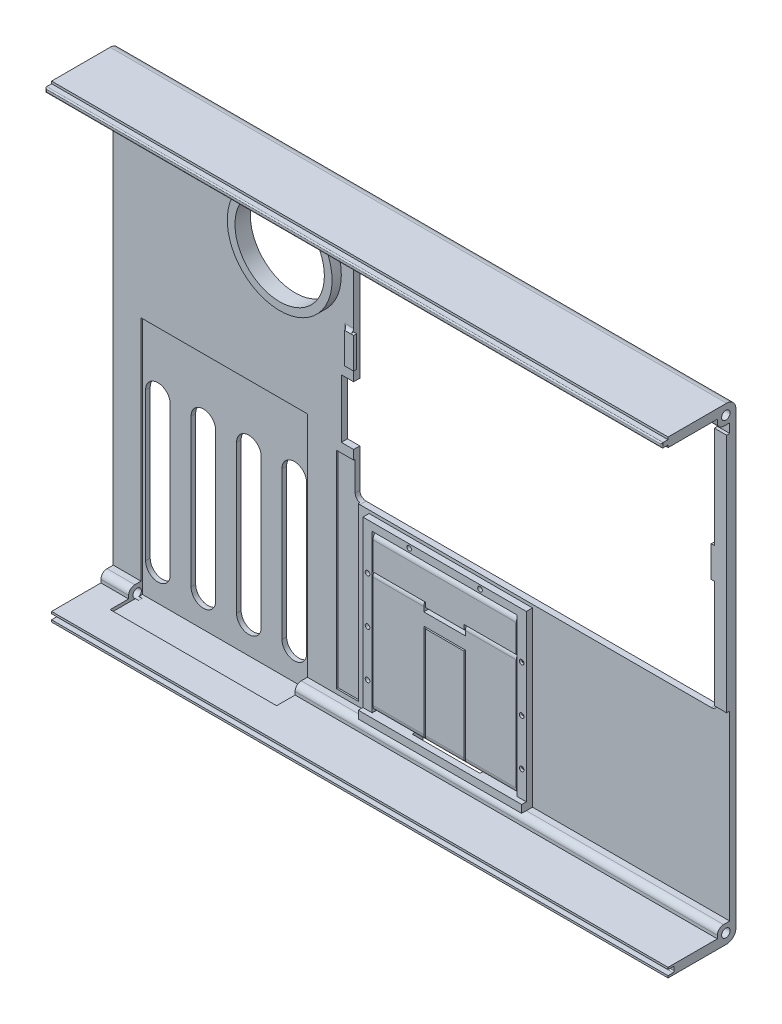
from build123d import *

# Parameters (mm, degrees)
SKETCH1_W                 = 200
SKETCH1_H                 = 152
BODY_DEPTH                = 2
SKETCH3_R                 = 14.5
FAN_EXHAUST_GRILL_DEPTH   = 139.567397543
SKETCH12_W                = 200
SKETCH12_H                = 6
SIDE_WALLS_DEPTH          = 20
MOUNT_HOLES_L_DEPTH       = 221.580877825
MOUNT_HOLES_L_DEPTH_BACK  = 10
SKETCH14_R                = 1.375
MOUNT_HOLES_R_START       = -10
SKETCH16_R                = 1.375
MOUNT_HOLES_R_DEPTH       = 10
SKETCH18_W                = 16
SKETCH18_H                = 3
WALL_REDUCE_DEPTH         = 221.580877825
SKETCH19_W                = 200
SKETCH19_H                = 1.7
GROOVE_DEPTH              = 2
SKETCH20_W                = 200
SKETCH20_H                = 1.5
NOTCH_DEPTH               = 2
SKETCH21_W                = 118
SKETCH21_H                = 82.5
BATT_CUT_DEPTH            = 141.288715376
FILLET1_R                 = 3
FILLET2_R                 = 2
FILLET3_R                 = 0.4
FILLET4_R                 = 2
SKETCH22_R                = 17
SKETCH22_R_2              = 14.5
FAN_HOLE_SUPP_DEPTH       = 3
SKETCH23_W                = 4
SKETCH23_H                = 78
BATT_CUT_SUPP_DEPTH       = 1
CUT_EXTRUDE1_START        = 10
SKETCH24_W                = 54
SKETCH24_H                = 78
SKETCH24_W_2              = 7
SKETCH24_H_2              = 67
CUT_EXTRUDE1_DEPTH        = 10.5
SKETCH25_W                = 4
SKETCH25_H                = 19
CUT_EXTRUDE2_DEPTH        = 141.288715376
SKETCH26_W                = 2
SKETCH26_H                = 10
BOSS_EXTRUDE1_DEPTH       = 1
SKETCH27_W                = 1
SKETCH27_H                = 10
BOSS_EXTRUDE2_DEPTH       = 1
SKETCH28_W                = 1
SKETCH28_H                = 10
BOSS_EXTRUDE3_DEPTH       = 1
FILLET5_R                 = 1
SKETCH29_W                = 47
SKETCH29_H                = 51
STAND_CUT_DEPTH           = 141.288715376
SKETCH30_W                = 53
SKETCH30_H                = 56
SKETCH30_W_2              = 47
SKETCH30_H_2              = 51
STAND_EXTRA_SUPPORT_DEPTH = 2
SKETCH31_R                = 1.125
SKETCH31_W                = 2.5
SKETCH31_H                = 43
STAND_RIGHT_GROOVE_DEPTH  = 2
STAND_LEFT_GROOVE_START   = -2
SKETCH32_R                = 1.125
SKETCH32_W                = 2.5
SKETCH32_H                = 43
STAND_LEFT_GROOVE_DEPTH   = 2
FILLET6_R                 = 1
SKETCH33_W                = 22
SKETCH33_H                = 4.5
FINGER_NOTCH_DEPTH        = 3.5
SKETCH34_W                = 53
SKETCH34_H                = 2.5
BACK_LID_EXT_DEPTH        = 1.5
SKETCH36_W                = 46.5
SKETCH36_H                = 50.5
ST_BODY_DEPTH             = 4
ST_BODY_CUT_DEPTH         = 4
FILLET8_R                 = 2
FILLET9_R                 = 2
FILLET10_R                = 2
ST_HINGE_HOLE_L_START     = -6.5
SKETCH39_R                = 1.25
ST_HINGE_HOLE_L_DEPTH     = 10
ST_HINGE_HOLE_R_START     = -6.5
SKETCH40_R                = 1.25
ST_HINGE_HOLE_R_DEPTH     = 10
ST_HINGE_ROD_START        = 7
SKETCH41_R                = 0.9
ST_HINGE_ROD_DEPTH        = 26.5
SKETCH44_R                = 1
ST_BUMPS_L_DEPTH          = 1.5
SKETCH45_R                = 1
ST_BUMPS_R_DEPTH          = 1.5
SKETCH46_R                = 1
ST_MINI_BUMP_L_DEPTH      = 0.75
SKETCH47_R                = 1
ST_MINI_BUMP_R_DEPTH      = 0.75
ST_HOOK_MATERIAL_R_DEPTH  = 17
LPATTERN1_COUNT           = 2
LPATTERN1_PITCH           = 29.5
SKETCH42_W                = 12.5
SKETCH42_H                = 6
ST_HOOK_CUT_DEPTH         = 2
SKETCH43_W                = 1.5
SKETCH43_H                = 4
ST_HOOK_DEPTH             = 13.5
FILLET11_R                = 4
SKETCH49_R                = 0.75
BACK_LID_HOLES_DEPTH      = 1


# Some blends are built 0.0001 mm under size
with BuildPart() as part:
    # Sketch1 → body (new body)
    with BuildSketch(Plane.XY):
        with Locations((5, -14.39869281)):
            Rectangle(SKETCH1_W, SKETCH1_H)
    extrude(amount=BODY_DEPTH)

    # Sketch3 → fan_exhaust_grill (cut, through all)
    with BuildSketch(Plane(origin=(0, 0, 0), x_dir=(-1, 0, 0), z_dir=(0, 0, -1))):
        with Locations((38, 34.10130719)):
            Circle(SKETCH3_R)
        with BuildLine():
            Line((62.25, -78.39869281), (62.25, -30.39869281))
            ThreePointArc((62.25, -30.39869281), (66.25, -26.39869281), (70.25, -30.39869281))
            Line((70.25, -30.39869281), (70.25, -78.39869281))
            ThreePointArc((70.25, -78.39869281), (66.25, -82.39869281), (62.25, -78.39869281))
        make_face()
        with BuildLine():
            Line((77, -78.39869281), (77, -30.39869281))
            ThreePointArc((77, -30.39869281), (81, -26.39869281), (85, -30.39869281))
            Line((85, -30.39869281), (85, -78.39869281))
            ThreePointArc((85, -78.39869281), (81, -82.39869281), (77, -78.39869281))
        make_face()
        with BuildLine():
            Line((47.5, -78.39869281), (47.5, -30.39869281))
            ThreePointArc((47.5, -30.39869281), (51.5, -26.39869281), (55.5, -30.39869281))
            Line((55.5, -30.39869281), (55.5, -78.39869281))
            ThreePointArc((55.5, -78.39869281), (51.5, -82.39869281), (47.5, -78.39869281))
        make_face()
        with BuildLine():
            Line((32.75, -78.39869281), (32.75, -30.39869281))
            ThreePointArc((32.75, -30.39869281), (36.75, -26.39869281), (40.75, -30.39869281))
            Line((40.75, -30.39869281), (40.75, -78.39869281))
            ThreePointArc((40.75, -78.39869281), (36.75, -82.39869281), (32.75, -78.39869281))
        make_face()
    extrude(amount=-FAN_EXHAUST_GRILL_DEPTH, mode=Mode.SUBTRACT)

    # Sketch12 → side_walls (add)
    with BuildSketch(Plane.XY.offset(2)):
        with Locations((5, -87.39869281)):
            Rectangle(SKETCH12_W, SKETCH12_H)
        with Locations((5, 58.60130719)):
            Rectangle(SKETCH12_W, SKETCH12_H)
    extrude(amount=SIDE_WALLS_DEPTH)

    # Sketch14 → mount_holes_l (cut, two sides: drawn at the far end of the back side and taken through both)
    with BuildSketch(Plane(origin=(105, 0, 0), x_dir=(0, 0, -1), z_dir=(1, 0, 0)).offset(-MOUNT_HOLES_L_DEPTH_BACK)):
        with Locations(Location((-3.25, -87.14869281, 0), (0, 0, 180))):
            Circle(SKETCH14_R)
        with Locations(Location((-3.25, 58.35130719, 0), (0, 0, 180))):
            Circle(SKETCH14_R)
    extrude(amount=MOUNT_HOLES_L_DEPTH + MOUNT_HOLES_L_DEPTH_BACK, mode=Mode.SUBTRACT)

    # Sketch16 → mount_holes_r (cut)
    with BuildSketch(Plane.ZY.offset(95).offset(MOUNT_HOLES_R_START)):
        with Locations((3.25, -87.14869281)):
            Circle(SKETCH16_R)
        with Locations((3.25, 58.35130719)):
            Circle(SKETCH16_R)
    extrude(amount=MOUNT_HOLES_R_DEPTH, mode=Mode.SUBTRACT)

    # Sketch18 → wall_reduce (cut, through all)
    with BuildSketch(Plane(origin=(105, 0, 0), x_dir=(0, 0, -1), z_dir=(1, 0, 0))):
        with Locations((-14, -85.89869281)):
            Rectangle(SKETCH18_W, SKETCH18_H)
        with Locations((-14, 57.10130719)):
            Rectangle(SKETCH18_W, SKETCH18_H)
    extrude(amount=-WALL_REDUCE_DEPTH, mode=Mode.SUBTRACT)

    # Sketch19 → groove (cut)
    with BuildSketch(Plane.XY.offset(22)):
        with Locations((5, -88.89869281)):
            Rectangle(SKETCH19_W, SKETCH19_H)
    extrude(amount=-GROOVE_DEPTH, mode=Mode.SUBTRACT)

    # Sketch20 → notch (add)
    with BuildSketch(Plane.XY.offset(22)):
        with Locations((5, 60.10130719)):
            Rectangle(SKETCH20_W, SKETCH20_H)
    extrude(amount=NOTCH_DEPTH)

    # Sketch21 → batt_cut (cut, through all)
    with BuildSketch(Plane.XY.offset(2)):
        with Locations((42, 13.85130719)):
            Rectangle(SKETCH21_W, SKETCH21_H)
    extrude(amount=-BATT_CUT_DEPTH, mode=Mode.SUBTRACT)

    # Fillet1
    fillet1_edges = [part.edges().sort_by_distance(p)[0] for p in [
        (5, 61.60130719, 0),
        (5, -90.39869281, 0),
    ]]
    fillet(fillet1_edges, radius=FILLET1_R)

    # Fillet2
    fillet2_edges = [part.edges().sort_by_distance(p)[0] for p in [
        (5, -84.39869281, 6),
        (5, 55.60130719, 6),
    ]]
    fillet(fillet2_edges, radius=FILLET2_R)

    # Fillet3
    fillet3_edges = [part.edges().sort_by_distance(p)[0] for p in [
        (5, -88.04869281, 20),
        (5, -89.74869281, 20),
        (-95, 60.10130719, 24),
        (5, 59.35130719, 24),
        (105, 60.10130719, 24),
        (5, 60.85130719, 24),
    ]]
    fillet(fillet3_edges, radius=FILLET3_R)

    # Fillet4
    fillet4_edges = [part.edges().sort_by_distance(p)[0] for p in [
        (101, 55.10130719, 1),
        (101, -27.39869281, 1),
        (-17, -27.39869281, 1),
        (-17, 55.10130719, 1),
    ]]
    fillet(fillet4_edges, radius=FILLET4_R)

    # Sketch22 → fan_hole_supp (add)
    with BuildSketch(Plane.XY.offset(2)):
        with Locations((-38, 34.10130719)):
            Circle(SKETCH22_R)
        with Locations(Location((-38, 34.10130719, 0), (0, 0, 180))):
            Circle(SKETCH22_R_2, mode=Mode.SUBTRACT)
    extrude(amount=FAN_HOLE_SUPP_DEPTH)

    # Sketch23 → batt_cut_supp (add)
    with BuildSketch(Plane.XY.offset(2)):
        with Locations((103, 13.60130719)):
            Rectangle(SKETCH23_W, SKETCH23_H)
    extrude(amount=BATT_CUT_SUPP_DEPTH)

    # Sketch24 → Cut-Extrude1 (cut)
    with BuildSketch(Plane.XY.offset(2).offset(CUT_EXTRUDE1_START)):
        with Locations((-59, -49.39869281)):
            Rectangle(SKETCH24_W, SKETCH24_H)
        with Locations((-19, -49.39869281)):
            Rectangle(SKETCH24_W_2, SKETCH24_H_2)
    extrude(amount=-CUT_EXTRUDE1_DEPTH, mode=Mode.SUBTRACT)

    # Sketch25 → Cut-Extrude2 (cut, through all)
    with BuildSketch(Plane.XY.offset(2)):
        with Locations((-19, -3.39869281)):
            Rectangle(SKETCH25_W, SKETCH25_H)
    extrude(amount=-CUT_EXTRUDE2_DEPTH, mode=Mode.SUBTRACT)

    # Sketch26 → Boss-Extrude1 (add)
    with BuildSketch(Plane.XY.offset(2)):
        with Locations((-18, 15.10130719)):
            Rectangle(SKETCH26_W, SKETCH26_H)
    extrude(amount=BOSS_EXTRUDE1_DEPTH)

    # Sketch27 → Boss-Extrude2 (add)
    with BuildSketch(Plane(origin=(-17, 0, 0), x_dir=(0, 0, -1), z_dir=(1, 0, 0))):
        with Locations((-2.5, 15.10130719)):
            Rectangle(SKETCH27_W, SKETCH27_H)
    extrude(amount=BOSS_EXTRUDE2_DEPTH)

    # Sketch28 → Boss-Extrude3 (add)
    with BuildSketch(Plane.ZY.offset(-101)):
        with Locations((2.5, 14.60130719)):
            Rectangle(SKETCH28_W, SKETCH28_H)
    extrude(amount=BOSS_EXTRUDE3_DEPTH)

    # Fillet5
    # the kernel refuses this fillet: 1 mm, written as the material it adds along each edge
    with BuildSketch(Plane(origin=(-17, 20.10130719, 2), x_dir=(0, 1, 0), z_dir=(-1, 0, 0))) as fillet5_piece_1_section:
        with BuildLine():
            CenterArc((FILLET5_R, -FILLET5_R), FILLET5_R, 90, 90)
            Line((0, -FILLET5_R), (-FILLET5_R * 0.02, -FILLET5_R))
            Line((-FILLET5_R * 0.02, -FILLET5_R), (-FILLET5_R * 0.02, FILLET5_R * 0.02))
            Line((-FILLET5_R * 0.02, FILLET5_R * 0.02), (FILLET5_R, FILLET5_R * 0.02))
            Line((FILLET5_R, FILLET5_R * 0.02), (FILLET5_R, 0))
        make_face()
    fillet5_piece_1 = extrude(amount=2, mode=Mode.PRIVATE)
    fillet5_piece_1 = split(fillet5_piece_1, bisect_by=Plane(origin=(-18, 20.304780319, 2), z_dir=(0, 0, 1)), keep=Keep.TOP, mode=Mode.PRIVATE)
    add(fillet5_piece_1)
    with BuildSketch(Plane(origin=(-19, 10.10130719, 2), x_dir=(0, -1, 0), z_dir=(1, 0, 0))) as fillet5_piece_2_section:
        with BuildLine():
            CenterArc((FILLET5_R, -FILLET5_R), FILLET5_R, 90, 90)
            Line((0, -FILLET5_R), (-FILLET5_R * 0.02, -FILLET5_R))
            Line((-FILLET5_R * 0.02, -FILLET5_R), (-FILLET5_R * 0.02, FILLET5_R * 0.02))
            Line((-FILLET5_R * 0.02, FILLET5_R * 0.02), (FILLET5_R, FILLET5_R * 0.02))
            Line((FILLET5_R, FILLET5_R * 0.02), (FILLET5_R, 0))
        make_face()
    fillet5_piece_2 = extrude(amount=2, mode=Mode.PRIVATE)
    fillet5_piece_2 = split(fillet5_piece_2, bisect_by=Plane(origin=(-18, 9.89783406, 2), z_dir=(0, 0, 1)), keep=Keep.TOP, mode=Mode.PRIVATE)
    add(fillet5_piece_2)
    with BuildSketch(Plane(origin=(-19, 20.10130719, 2), x_dir=(-1, 0, 0), z_dir=(0, -1, 0))) as fillet5_piece_3:
        with BuildLine():
            CenterArc((FILLET5_R, -FILLET5_R), FILLET5_R, 90, 90)
            Line((0, -FILLET5_R), (-FILLET5_R * 0.02, -FILLET5_R))
            Line((-FILLET5_R * 0.02, -FILLET5_R), (-FILLET5_R * 0.02, FILLET5_R * 0.02))
            Line((-FILLET5_R * 0.02, FILLET5_R * 0.02), (FILLET5_R, FILLET5_R * 0.02))
            Line((FILLET5_R, FILLET5_R * 0.02), (FILLET5_R, 0))
        make_face()
    extrude(amount=10)
    with BuildSketch(Plane(origin=(-19, 22.60130719, 2), x_dir=(-1, 0, 0), z_dir=(0, -1, 0))) as fillet5_piece_4a_section:
        with BuildLine():
            CenterArc((FILLET5_R, -FILLET5_R), FILLET5_R, 90, 90)
            Line((0, -FILLET5_R), (-FILLET5_R * 0.02, -FILLET5_R))
            Line((-FILLET5_R * 0.02, -FILLET5_R), (-FILLET5_R * 0.02, FILLET5_R * 0.02))
            Line((-FILLET5_R * 0.02, FILLET5_R * 0.02), (FILLET5_R, FILLET5_R * 0.02))
            Line((FILLET5_R, FILLET5_R * 0.02), (FILLET5_R, 0))
        make_face()
    fillet5_piece_4a = extrude(amount=12.5, mode=Mode.PRIVATE)
    fillet5_piece_4a = split(fillet5_piece_4a, bisect_by=Plane(origin=(-19.226395114, 20.10130719, 2.226395114), z_dir=(0, 1, 0)), keep=Keep.TOP, mode=Mode.PRIVATE)
    with BuildSketch(Plane(origin=(-17, 20.10130719, 2), x_dir=(0, 1, 0), z_dir=(-1, 0, 0))) as fillet5_piece_4b_section:
        with BuildLine():
            CenterArc((FILLET5_R, -FILLET5_R), FILLET5_R, 90, 90)
            Line((0, -FILLET5_R), (-FILLET5_R * 0.02, -FILLET5_R))
            Line((-FILLET5_R * 0.02, -FILLET5_R), (-FILLET5_R * 0.02, FILLET5_R * 0.02))
            Line((-FILLET5_R * 0.02, FILLET5_R * 0.02), (FILLET5_R, FILLET5_R * 0.02))
            Line((FILLET5_R, FILLET5_R * 0.02), (FILLET5_R, 0))
        make_face()
    fillet5_piece_4b = extrude(amount=4.5, mode=Mode.PRIVATE)
    fillet5_piece_4b = split(fillet5_piece_4b, bisect_by=Plane(origin=(-20.25, 20.304780319, 2), z_dir=(0, 0, 1)), keep=Keep.TOP, mode=Mode.PRIVATE)
    fillet5_piece_4b = split(fillet5_piece_4b, bisect_by=Plane(origin=(-19, 20.304780319, 2.24695105), z_dir=(-1, 0, 0)), keep=Keep.TOP, mode=Mode.PRIVATE)
    fillet5_piece_4 = fillet5_piece_4a & fillet5_piece_4b
    add(fillet5_piece_4)
    with BuildSketch(Plane(origin=(-19, 22.60130719, 2), x_dir=(-1, 0, 0), z_dir=(0, -1, 0))) as fillet5_piece_5a_section:
        with BuildLine():
            CenterArc((FILLET5_R, -FILLET5_R), FILLET5_R, 90, 90)
            Line((0, -FILLET5_R), (-FILLET5_R * 0.02, -FILLET5_R))
            Line((-FILLET5_R * 0.02, -FILLET5_R), (-FILLET5_R * 0.02, FILLET5_R * 0.02))
            Line((-FILLET5_R * 0.02, FILLET5_R * 0.02), (FILLET5_R, FILLET5_R * 0.02))
            Line((FILLET5_R, FILLET5_R * 0.02), (FILLET5_R, 0))
        make_face()
    fillet5_piece_5a = extrude(amount=12.5, mode=Mode.PRIVATE)
    fillet5_piece_5a = split(fillet5_piece_5a, bisect_by=Plane(origin=(-19.226395114, 20.10130719, 2.226395114), z_dir=(0, 1, 0)), keep=Keep.TOP, mode=Mode.PRIVATE)
    with BuildSketch(Plane(origin=(-17, 20.10130719, 2), x_dir=(0, 1, 0), z_dir=(-1, 0, 0))) as fillet5_piece_5b_section:
        with BuildLine():
            CenterArc((FILLET5_R, -FILLET5_R), FILLET5_R, 90, 90)
            Line((0, -FILLET5_R), (-FILLET5_R * 0.02, -FILLET5_R))
            Line((-FILLET5_R * 0.02, -FILLET5_R), (-FILLET5_R * 0.02, FILLET5_R * 0.02))
            Line((-FILLET5_R * 0.02, FILLET5_R * 0.02), (FILLET5_R, FILLET5_R * 0.02))
            Line((FILLET5_R, FILLET5_R * 0.02), (FILLET5_R, 0))
        make_face()
    fillet5_piece_5b = extrude(amount=2, mode=Mode.PRIVATE)
    fillet5_piece_5b = split(fillet5_piece_5b, bisect_by=Plane(origin=(-18, 20.59130719, 2), z_dir=(0, 0, -1)), keep=Keep.TOP, mode=Mode.PRIVATE)
    fillet5_piece_5 = fillet5_piece_5a & fillet5_piece_5b
    add(fillet5_piece_5)
    with BuildSketch(Plane(origin=(-19, 22.60130719, 2), x_dir=(-1, 0, 0), z_dir=(0, -1, 0))) as fillet5_piece_6a_section:
        with BuildLine():
            CenterArc((FILLET5_R, -FILLET5_R), FILLET5_R, 90, 90)
            Line((0, -FILLET5_R), (-FILLET5_R * 0.02, -FILLET5_R))
            Line((-FILLET5_R * 0.02, -FILLET5_R), (-FILLET5_R * 0.02, FILLET5_R * 0.02))
            Line((-FILLET5_R * 0.02, FILLET5_R * 0.02), (FILLET5_R, FILLET5_R * 0.02))
            Line((FILLET5_R, FILLET5_R * 0.02), (FILLET5_R, 0))
        make_face()
    fillet5_piece_6a = extrude(amount=12.5, mode=Mode.PRIVATE)
    fillet5_piece_6a = split(fillet5_piece_6a, bisect_by=Plane(origin=(-19.226395114, 20.10130719, 2.226395114), z_dir=(0, 1, 0)), keep=Keep.TOP, mode=Mode.PRIVATE)
    with BuildSketch(Plane(origin=(-17, 20.10130719, 2), x_dir=(0, 1, 0), z_dir=(-1, 0, 0))) as fillet5_piece_6b_section:
        with BuildLine():
            CenterArc((FILLET5_R, -FILLET5_R), FILLET5_R, 90, 90)
            Line((0, -FILLET5_R), (-FILLET5_R * 0.02, -FILLET5_R))
            Line((-FILLET5_R * 0.02, -FILLET5_R), (-FILLET5_R * 0.02, FILLET5_R * 0.02))
            Line((-FILLET5_R * 0.02, FILLET5_R * 0.02), (FILLET5_R, FILLET5_R * 0.02))
            Line((FILLET5_R, FILLET5_R * 0.02), (FILLET5_R, 0))
        make_face()
    fillet5_piece_6b = extrude(amount=4.5, mode=Mode.PRIVATE)
    fillet5_piece_6b = split(fillet5_piece_6b, bisect_by=Plane(origin=(-20.25, 20.59130719, 2), z_dir=(0, 0, -1)), keep=Keep.TOP, mode=Mode.PRIVATE)
    fillet5_piece_6b = split(fillet5_piece_6b, bisect_by=Plane(origin=(-19, 20.59130719, 1.99), z_dir=(-1, 0, 0)), keep=Keep.TOP, mode=Mode.PRIVATE)
    fillet5_piece_6 = fillet5_piece_6a & fillet5_piece_6b
    add(fillet5_piece_6)
    with BuildSketch(Plane(origin=(-21.5, 10.10130719, 2), x_dir=(0, -1, 0), z_dir=(1, 0, 0))) as fillet5_piece_7a_section:
        with BuildLine():
            CenterArc((FILLET5_R, -FILLET5_R), FILLET5_R, 90, 90)
            Line((0, -FILLET5_R), (-FILLET5_R * 0.02, -FILLET5_R))
            Line((-FILLET5_R * 0.02, -FILLET5_R), (-FILLET5_R * 0.02, FILLET5_R * 0.02))
            Line((-FILLET5_R * 0.02, FILLET5_R * 0.02), (FILLET5_R, FILLET5_R * 0.02))
            Line((FILLET5_R, FILLET5_R * 0.02), (FILLET5_R, 0))
        make_face()
    fillet5_piece_7a = extrude(amount=4.5, mode=Mode.PRIVATE)
    fillet5_piece_7a = split(fillet5_piece_7a, bisect_by=Plane(origin=(-20.25, 9.89783406, 2), z_dir=(0, 0, 1)), keep=Keep.TOP, mode=Mode.PRIVATE)
    fillet5_piece_7a = split(fillet5_piece_7a, bisect_by=Plane(origin=(-19, 9.89783406, 2.24695105), z_dir=(-1, 0, 0)), keep=Keep.TOP, mode=Mode.PRIVATE)
    with BuildSketch(Plane(origin=(-19, 20.10130719, 2), x_dir=(-1, 0, 0), z_dir=(0, -1, 0))) as fillet5_piece_7b_section:
        with BuildLine():
            CenterArc((FILLET5_R, -FILLET5_R), FILLET5_R, 90, 90)
            Line((0, -FILLET5_R), (-FILLET5_R * 0.02, -FILLET5_R))
            Line((-FILLET5_R * 0.02, -FILLET5_R), (-FILLET5_R * 0.02, FILLET5_R * 0.02))
            Line((-FILLET5_R * 0.02, FILLET5_R * 0.02), (FILLET5_R, FILLET5_R * 0.02))
            Line((FILLET5_R, FILLET5_R * 0.02), (FILLET5_R, 0))
        make_face()
    fillet5_piece_7b = extrude(amount=12.5, mode=Mode.PRIVATE)
    fillet5_piece_7b = split(fillet5_piece_7b, bisect_by=Plane(origin=(-19.226395114, 10.10130719, 2.226395114), z_dir=(0, -1, 0)), keep=Keep.TOP, mode=Mode.PRIVATE)
    fillet5_piece_7 = fillet5_piece_7a & fillet5_piece_7b
    add(fillet5_piece_7)
    with BuildSketch(Plane(origin=(-21.5, 10.10130719, 2), x_dir=(0, -1, 0), z_dir=(1, 0, 0))) as fillet5_piece_8a_section:
        with BuildLine():
            CenterArc((FILLET5_R, -FILLET5_R), FILLET5_R, 90, 90)
            Line((0, -FILLET5_R), (-FILLET5_R * 0.02, -FILLET5_R))
            Line((-FILLET5_R * 0.02, -FILLET5_R), (-FILLET5_R * 0.02, FILLET5_R * 0.02))
            Line((-FILLET5_R * 0.02, FILLET5_R * 0.02), (FILLET5_R, FILLET5_R * 0.02))
            Line((FILLET5_R, FILLET5_R * 0.02), (FILLET5_R, 0))
        make_face()
    fillet5_piece_8a = extrude(amount=4.5, mode=Mode.PRIVATE)
    fillet5_piece_8a = split(fillet5_piece_8a, bisect_by=Plane(origin=(-20.25, 9.61130719, 2), z_dir=(0, 0, -1)), keep=Keep.TOP, mode=Mode.PRIVATE)
    fillet5_piece_8a = split(fillet5_piece_8a, bisect_by=Plane(origin=(-19, 9.61130719, 1.99), z_dir=(-1, 0, 0)), keep=Keep.TOP, mode=Mode.PRIVATE)
    with BuildSketch(Plane(origin=(-19, 20.10130719, 2), x_dir=(-1, 0, 0), z_dir=(0, -1, 0))) as fillet5_piece_8b_section:
        with BuildLine():
            CenterArc((FILLET5_R, -FILLET5_R), FILLET5_R, 90, 90)
            Line((0, -FILLET5_R), (-FILLET5_R * 0.02, -FILLET5_R))
            Line((-FILLET5_R * 0.02, -FILLET5_R), (-FILLET5_R * 0.02, FILLET5_R * 0.02))
            Line((-FILLET5_R * 0.02, FILLET5_R * 0.02), (FILLET5_R, FILLET5_R * 0.02))
            Line((FILLET5_R, FILLET5_R * 0.02), (FILLET5_R, 0))
        make_face()
    fillet5_piece_8b = extrude(amount=12.5, mode=Mode.PRIVATE)
    fillet5_piece_8b = split(fillet5_piece_8b, bisect_by=Plane(origin=(-19.226395114, 10.10130719, 2.226395114), z_dir=(0, -1, 0)), keep=Keep.TOP, mode=Mode.PRIVATE)
    fillet5_piece_8 = fillet5_piece_8a & fillet5_piece_8b
    add(fillet5_piece_8)
    with BuildSketch(Plane(origin=(-19, 10.10130719, 2), x_dir=(0, -1, 0), z_dir=(1, 0, 0))) as fillet5_piece_9a_section:
        with BuildLine():
            CenterArc((FILLET5_R, -FILLET5_R), FILLET5_R, 90, 90)
            Line((0, -FILLET5_R), (-FILLET5_R * 0.02, -FILLET5_R))
            Line((-FILLET5_R * 0.02, -FILLET5_R), (-FILLET5_R * 0.02, FILLET5_R * 0.02))
            Line((-FILLET5_R * 0.02, FILLET5_R * 0.02), (FILLET5_R, FILLET5_R * 0.02))
            Line((FILLET5_R, FILLET5_R * 0.02), (FILLET5_R, 0))
        make_face()
    fillet5_piece_9a = extrude(amount=2, mode=Mode.PRIVATE)
    fillet5_piece_9a = split(fillet5_piece_9a, bisect_by=Plane(origin=(-18, 9.61130719, 2), z_dir=(0, 0, -1)), keep=Keep.TOP, mode=Mode.PRIVATE)
    with BuildSketch(Plane(origin=(-19, 20.10130719, 2), x_dir=(-1, 0, 0), z_dir=(0, -1, 0))) as fillet5_piece_9b_section:
        with BuildLine():
            CenterArc((FILLET5_R, -FILLET5_R), FILLET5_R, 90, 90)
            Line((0, -FILLET5_R), (-FILLET5_R * 0.02, -FILLET5_R))
            Line((-FILLET5_R * 0.02, -FILLET5_R), (-FILLET5_R * 0.02, FILLET5_R * 0.02))
            Line((-FILLET5_R * 0.02, FILLET5_R * 0.02), (FILLET5_R, FILLET5_R * 0.02))
            Line((FILLET5_R, FILLET5_R * 0.02), (FILLET5_R, 0))
        make_face()
    fillet5_piece_9b = extrude(amount=12.5, mode=Mode.PRIVATE)
    fillet5_piece_9b = split(fillet5_piece_9b, bisect_by=Plane(origin=(-19.226395114, 10.10130719, 2.226395114), z_dir=(0, -1, 0)), keep=Keep.TOP, mode=Mode.PRIVATE)
    fillet5_piece_9 = fillet5_piece_9a & fillet5_piece_9b
    add(fillet5_piece_9)

    # Sketch29 → stand_cut (cut, through all)
    with BuildSketch(Plane.XY.offset(2)):
        with Locations((14.5, -56.39869281)):
            Rectangle(SKETCH29_W, SKETCH29_H)
    extrude(amount=-STAND_CUT_DEPTH, mode=Mode.SUBTRACT)

    # Sketch30 → stand_extra_support (add)
    with BuildSketch(Plane.XY.offset(2)):
        with Locations((14.5, -56.39869281)):
            Rectangle(SKETCH30_W, SKETCH30_H)
        with Locations((14.5, -56.39869281)):
            Rectangle(SKETCH30_W_2, SKETCH30_H_2, mode=Mode.SUBTRACT)
    extrude(amount=STAND_EXTRA_SUPPORT_DEPTH)

    # Sketch31 → stand_right_groove (cut)
    with BuildSketch(Plane(origin=(-9, 0, 0), x_dir=(0, 0, -1), z_dir=(1, 0, 0))):
        with Locations(Location((-2, -33.14869281, 0), (0, 0, 90))):
            Circle(SKETCH31_R)
        with Locations((-2, -59.39869281)):
            Rectangle(SKETCH31_W, SKETCH31_H)
    extrude(amount=-STAND_RIGHT_GROOVE_DEPTH, mode=Mode.SUBTRACT)

    # Sketch32 → stand_left_groove (cut)
    with BuildSketch(Plane.ZY.offset(-38).offset(STAND_LEFT_GROOVE_START)):
        with Locations(Location((2, -33.14869281, 0), (0, 0, 90))):
            Circle(SKETCH32_R)
        with Locations((2, -59.39869281)):
            Rectangle(SKETCH32_W, SKETCH32_H)
    extrude(amount=STAND_LEFT_GROOVE_DEPTH, mode=Mode.SUBTRACT)

    # Fillet6
    fillet6_edges = [part.edges().sort_by_distance(p)[0] for p in [
        (-11, -59.39869281, 3.25),
        (-11, -37.89869281, 2),
        (-11, -59.39869281, 0.75),
        (-11, -80.89869281, 2),
        (40, -59.39869281, 0.75),
        (40, -37.89869281, 2),
        (40, -59.39869281, 3.25),
        (40, -80.89869281, 2),
    ]]
    fillet(fillet6_edges, radius=FILLET6_R)

    # Sketch33 → finger_notch (cut)
    with BuildSketch(Plane(origin=(0, 0, 0), x_dir=(-1, 0, 0), z_dir=(0, 0, -1))):
        with Locations((-14.5, -84.14869281)):
            Rectangle(SKETCH33_W, SKETCH33_H)
    extrude(amount=-FINGER_NOTCH_DEPTH, mode=Mode.SUBTRACT)

    # Sketch34 → back_lid_ext (add)
    with BuildSketch(Plane.XY.offset(4)):
        with Locations((14.5, -83.14869281)):
            Rectangle(SKETCH34_W, SKETCH34_H)
    extrude(amount=BACK_LID_EXT_DEPTH)

    # Fillet11
    # the kernel refuses this fillet: 4 mm, written as the material it adds along each edge
    with BuildSketch(Plane(origin=(-6.421567416, -86.39869281, 3.5), x_dir=(0, 1, 0), z_dir=(1, 0, 0))) as fillet11_piece_1:
        with BuildLine():
            CenterArc((3.968626967, -4), FILLET11_R, 90, 82.819244219)
            Line((0, -3.5), (-0.079372539, -3.49))
            ThreePointArc((-0.079372539, -3.49), (-0.08, -1.75), (-0.08, 0))
            Line((-0.08, 0), (0, 0.08))
            Line((0, 0.08), (3.968626967, 0.08))
            Line((3.968626967, 0.08), (3.968626967, 0))
        make_face()
    extrude(amount=41.843134833)

    # Sketch49 → back_lid_holes (cut)
    with BuildSketch(Plane.XY.offset(4)):
        with Locations((3, -29.64869281)):
            Circle(SKETCH49_R)
        with Locations((26, -29.64869281)):
            Circle(SKETCH49_R)
        with Locations((-10.5, -43.39869281)):
            Circle(SKETCH49_R)
        with Locations((-10.5, -58.39869281)):
            Circle(SKETCH49_R)
        with Locations((-10.5, -73.39869281)):
            Circle(SKETCH49_R)
        with Locations((39.5, -58.39869281)):
            Circle(SKETCH49_R)
        with Locations((39.5, -73.39869281)):
            Circle(SKETCH49_R)
        with Locations((39.5, -43.39869281)):
            Circle(SKETCH49_R)
    extrude(amount=-BACK_LID_HOLES_DEPTH, mode=Mode.SUBTRACT)


with BuildPart() as body_2:
    # Sketch36 → st_body (new body)
    with BuildSketch(Plane(origin=(0, 0, 0), x_dir=(-1, 0, 0), z_dir=(0, 0, -1))):
        with Locations((-14.5, -56.39869281)):
            Rectangle(SKETCH36_W, SKETCH36_H)
    extrude(amount=-ST_BODY_DEPTH)

    # Sketch37 → st_body_cut (cut)
    with BuildSketch(Plane(origin=(0, 0, 0), x_dir=(-1, 0, 0), z_dir=(0, 0, -1))):
        Polygon((-37.75, -41.14869281), (-20.75, -41.14869281), (-20.75, -81.64869281), (-21.25, -81.64869281), (-21.25, -41.64869281), (-37.75, -41.64869281), align=None)
        Polygon((8.75, -41.14869281), (-8.25, -41.14869281), (-8.25, -81.64869281), (-7.75, -81.64869281), (-7.75, -41.64869281), (8.75, -41.64869281), align=None)
    extrude(amount=-ST_BODY_CUT_DEPTH, mode=Mode.SUBTRACT)


with BuildPart() as st_body_cut_piece_1:
    # of the separate pieces the step leaves, piece 1, a body of its own (st_body_cut_pieces)
    add(body_2.part.solids().sort_by_distance((37.75, -31.14869281, 0))[0])

    # Fillet10
    fillet10_edges = [st_body_cut_piece_1.edges().sort_by_distance(p)[0] for p in [
        (14.5, -31.14869281, 0),
        (14.5, -81.64869281, 0),
        (14.5, -81.64869281, 4),
        (14.5, -31.14869281, 4),
    ]]
    fillet(fillet10_edges, radius=FILLET10_R - 0.0001)  # a hair under: the kernel refuses the full size

    # Sketch41 → st_hinge_rod (add)
    with BuildSketch(Plane(origin=(20.75, 0, 0), x_dir=(0, 0, -1), z_dir=(1, 0, 0)).offset(ST_HINGE_ROD_START)):
        with Locations(Location((-2, -79.64869281, 0), (0, 0, 90))):
            Circle(SKETCH41_R)
    extrude(amount=-ST_HINGE_ROD_DEPTH)

    # Sketch44 → st_bumps_l (add)
    with BuildSketch(Plane.ZY.offset(8.75)):
        with Locations(Location((2, -33.14869281, 0), (0, 0, 270))):
            Circle(SKETCH44_R)
        with Locations(Location((2, -43.64869281, 0), (0, 0, 270))):
            Circle(SKETCH44_R)
    extrude(amount=ST_BUMPS_L_DEPTH)


with BuildPart() as st_body_cut_piece_2:
    # of the separate pieces the step leaves, piece 2, a body of its own (st_body_cut_pieces)
    add(body_2.part.solids().sort_by_distance((37.75, -81.64869281, 0))[0])

    # Fillet8
    fillet8_edges = [st_body_cut_piece_2.edges().sort_by_distance(p)[0] for p in [
        (29.5, -41.64869281, 4),
        (29.5, -41.64869281, 0),
        (29.5, -81.64869281, 4),
        (29.5, -81.64869281, 0),
    ]]
    fillet(fillet8_edges, radius=FILLET8_R - 0.0001)  # a hair under: the kernel refuses the full size

    # Sketch40 → st_hinge_hole_r (cut)
    with BuildSketch(Plane(origin=(37.75, 0, 0), x_dir=(0, 0, -1), z_dir=(1, 0, 0)).offset(ST_HINGE_HOLE_R_START)):
        with Locations(Location((-2, -79.64869281, 0), (0, 0, 270))):
            Circle(SKETCH40_R)
    extrude(amount=-ST_HINGE_HOLE_R_DEPTH, mode=Mode.SUBTRACT)



with BuildPart() as st_body_cut_piece_3:
    # of the separate pieces the step leaves, piece 3, a body of its own (st_body_cut_pieces)
    add(body_2.part.solids().sort_by_distance((-8.75, -41.64869281, 0))[0])

    # Fillet9
    fillet9_edges = [st_body_cut_piece_3.edges().sort_by_distance(p)[0] for p in [
        (-0.5, -41.64869281, 4),
        (-0.5, -81.64869281, 4),
        (-0.5, -81.64869281, 0),
        (-0.5, -41.64869281, 0),
    ]]
    fillet(fillet9_edges, radius=FILLET9_R - 0.0001)  # a hair under: the kernel refuses the full size

    # Sketch39 → st_hinge_hole_l (cut)
    with BuildSketch(Plane.ZY.offset(8.75).offset(ST_HINGE_HOLE_L_START)):
        with Locations(Location((2, -79.64869281, 0), (0, 0, 270))):
            Circle(SKETCH39_R)
    extrude(amount=-ST_HINGE_HOLE_L_DEPTH, mode=Mode.SUBTRACT)


with BuildPart() as st_bumps_l_piece_1:
    # of the separate pieces the step leaves, piece 1, a body of its own (st_bumps_l_pieces)
    add(st_body_cut_piece_1.part.solids().sort_by_distance((37.75, -31.14869281, 1.9999))[0])

    # Sketch45 → st_bumps_r (add)
    with BuildSketch(Plane(origin=(37.75, 0, 0), x_dir=(0, 0, -1), z_dir=(1, 0, 0))):
        with Locations(Location((-2, -43.64869281, 0), (0, 0, 90))):
            Circle(SKETCH45_R)
        with Locations(Location((-2, -33.14869281, 0), (0, 0, 270))):
            Circle(SKETCH45_R)
    extrude(amount=ST_BUMPS_R_DEPTH)


with BuildPart() as st_bumps_l_piece_2:
    # of the separate pieces the step leaves, piece 2, a body of its own (st_bumps_l_pieces)
    add(st_body_cut_piece_1.part.solids().sort_by_distance((-8.75, -44.64869281, 2))[0])


with BuildPart() as st_bumps_r_piece_1:
    # of the separate pieces the step leaves, piece 1, a body of its own (st_bumps_r_pieces)
    add(st_bumps_l_piece_1.part.solids().sort_by_distance((37.75, -31.14869281, 1.9999))[0])

    # Sketch48 → st_hook_material_r (add)
    with BuildSketch(Plane(origin=(37.75, 0, 0), x_dir=(0, 0, -1), z_dir=(1, 0, 0))):
        with BuildLine():
            Line((0, -42.14869281), (0, -40.64869281))
            Line((0, -40.64869281), (-4, -40.64869281))
            Line((-4, -40.64869281), (-4, -42.14869281))
            ThreePointArc((-4, -42.14869281), (-2, -41.14869281), (0, -42.14869281))
        make_face()
    st_hook_material_r = extrude(amount=-ST_HOOK_MATERIAL_R_DEPTH)

    # LPattern1: st_hook_material_r ×2
    with Locations(*[(-i * LPATTERN1_PITCH, 0, 0) for i in range(1, LPATTERN1_COUNT)]):
        add(st_hook_material_r)

    # Sketch42 → st_hook_cut (cut)
    with BuildSketch(Plane(origin=(0, 0, 4), x_dir=(-1, 0, 0), z_dir=(0, 0, -1))):
        with Locations((-14.5, -46.64869281)):
            Rectangle(SKETCH42_W, SKETCH42_H)
    extrude(amount=ST_HOOK_CUT_DEPTH, mode=Mode.SUBTRACT)


with BuildPart() as st_bumps_r_piece_2:
    # of the separate pieces the step leaves, piece 2, a body of its own (st_bumps_r_pieces)
    add(st_bumps_l_piece_1.part.solids().sort_by_distance((37.75, -42.64869281, 2))[0])


with BuildPart() as body_7:
    # Sketch46 → st_mini_bump_l (new body)
    with BuildSketch(Plane.ZY.offset(8.75)):
        with Locations(Location((2, -79.64869281, 0), (0, 0, 270))):
            Circle(SKETCH46_R)
    extrude(amount=ST_MINI_BUMP_L_DEPTH)


with BuildPart() as body_8:
    # Sketch47 → st_mini_bump_r (new body)
    with BuildSketch(Plane(origin=(37.75, 0, 0), x_dir=(0, 0, -1), z_dir=(1, 0, 0))):
        with Locations(Location((-2, -79.64869281, 0), (0, 0, 90))):
            Circle(SKETCH47_R)
    extrude(amount=ST_MINI_BUMP_R_DEPTH)


with BuildPart() as st_body_cut_piece_2_1:
    add(st_body_cut_piece_2.part)

    add(st_body_cut_piece_3.part)  # st_hook merges st_body_cut piece 3
    # Sketch43 → st_hook (add)
    with BuildSketch(Plane.ZY.offset(-7.75)):
        with Locations((3.25, -47.14869281)):
            Rectangle(SKETCH43_W, SKETCH43_H)
    extrude(amount=-ST_HOOK_DEPTH)


solid = Compound([part.part, st_bumps_l_piece_2.part, st_bumps_r_piece_1.part, st_bumps_r_piece_2.part, body_7.part, body_8.part, st_body_cut_piece_2_1.part])
